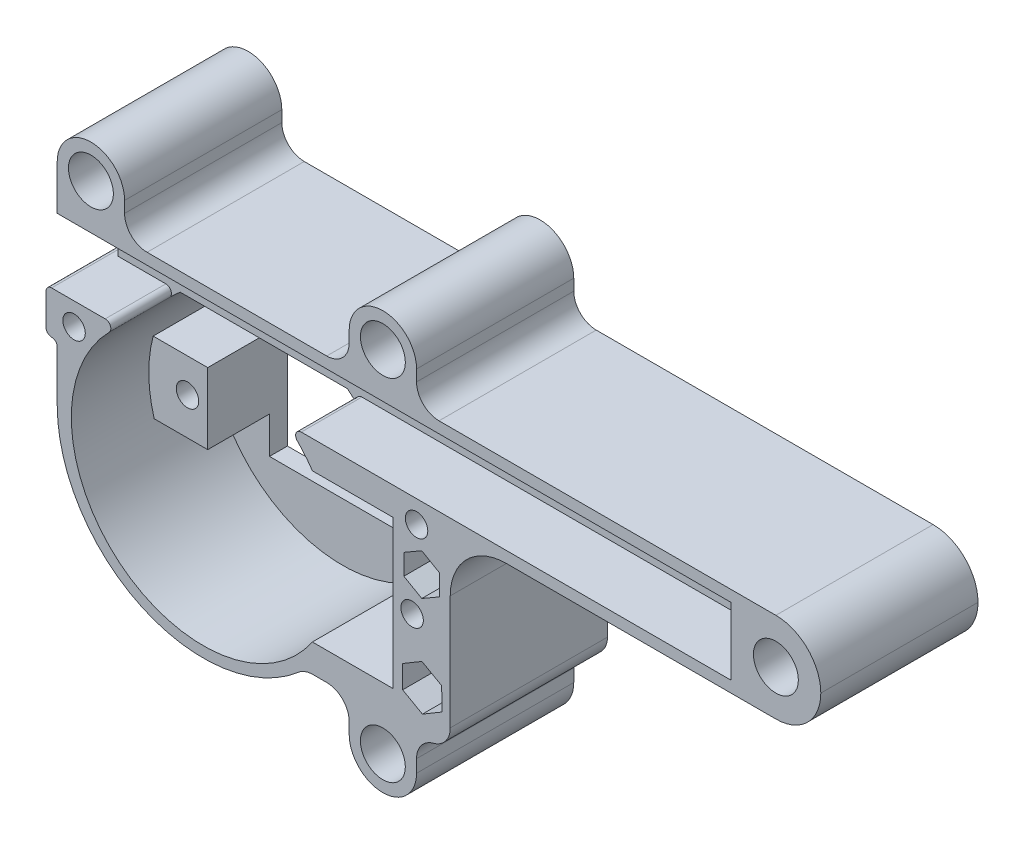
from build123d import *

# Parameters (mm, degrees)
BODY_DEPTH                      = 14
HAUPTAUSTRAGUNG_DEPTH           = 6.9
SERVOSCHNITT_DEPTH              = 69.010587411
SERVOSCHNITT_DEPTH_BACK         = 69.010587411
SERVO_W                         = 23.4
SERVO_H                         = 13.2
VERRUNDUNG2_R                   = 5
SCHRAUBENLOCH_DEPTH             = 69.010587411
SCHRAUBENLOCH_DEPTH_BACK        = 69.010587411
SERVOLOCHSCHRAUBEN_R            = 1
FUEHRUNG_W                      = 60
FUEHRUNG_H                      = 2.5
FUEHRUNGSSCHINE_DEPTH           = 1.5
VERRUNDUNG4_R                   = 2
HALTERUNG_R                     = 1
SCHNITT_LINEAR_AUSTRAGEN2_DEPTH = 69.010587411
SKIZZE5_R                       = 1
SCHNITT_LINEAR_AUSTRAGEN3_DEPTH = 69.010587411
SCHNITT_LINEAR_START            = -6
SKIZZE8_W                       = 2.673131507
SKIZZE8_H                       = 5.13849065
SCHNITT_LINEAR_AUSTRAGEN7_DEPTH = 73.931681587
LINEARES_MUSTER1_COUNT          = 11
LINEARES_MUSTER1_PITCH          = 5
SABSCHLUSS_W                    = 8
SABSCHLUSS_H                    = 8
ABSCHLUSS_DEPTH                 = 14
SKIZZE14_R                      = 2
ENDSTUTZEN_DEPTH                = 14
SKIZZESTUTZEN_R                 = 2
STUTZEN_DEPTH                   = 14
VERRUNDUNG5_R                   = 4
VERRUNDUNG6_R                   = 2
VERRUNDUNG7_R                   = 2
SECHSKANTLOCH_DEPTH             = 13
HALTERUNGLINKS_DEPTH            = 5.5
SKIZZE15_R                      = 2
AUFSATZ_LINEAR_AUSTRAGEN1_DEPTH = 14
VERRUNDUNG8_R                   = 2
SKIZZE16_W                      = 1
SKIZZE16_H                      = 3.8
AUFSATZ_LINEAR_AUSTRAGEN2_DEPTH = 14
VERRUNDUNG10_R                  = 0.5
VERRUNDUNG11_R                  = 0.5
VERRUNDUNG12_R                  = 0.5


with BuildPart() as part:
    # P-BodySkizze → body (new body)
    with BuildSketch(Plane.XY):
        with BuildLine():
            Line((0, 0), (60, 0))
            Line((60, 0), (60, -8))
            Line((60, -8), (35, -8))
            Line((35, -8), (35, -25.18083152))
            Line((35, -25.18083152), (22, -25.18083152))
            ThreePointArc((22, -25.18083152), (17.850215987, -27.861318538), (13, -28.8))
            ThreePointArc((13, -28.8), (3.807611845, -24.992388155), (0, -15.8))
            Line((0, -15.8), (0, 0))
        make_face()
    extrude(amount=BODY_DEPTH)

    # Austrag → hauptAustragung (cut)
    with BuildSketch(Plane.XY.offset(14)):
        with BuildLine():
            ThreePointArc((20.443697295, -7), (13.002720829, -4.343644442), (5.561744363, -7))
            Line((5.561744363, -7), (20.443697295, -7))
        make_face()
        with BuildLine():
            Line((20.443697295, -7), (5.561744363, -7))
            ThreePointArc((5.561744363, -7), (7.971268428, -26.711882843), (24.752720829, -16.093644442))
            ThreePointArc((24.752720829, -16.093644442), (23.62095923, -11.062192041), (20.443697295, -7))
        make_face()
        with BuildLine():
            Line((60, -1), (0, -1))
            Line((0, -1), (0, -7))
            Line((0, -7), (5.561744363, -7))
            ThreePointArc((5.561744363, -7), (13.002720829, -4.343644442), (20.443697295, -7))
            Line((20.443697295, -7), (60, -7))
            Line((60, -7), (60, -1))
        make_face()
    extrude(amount=-HAUPTAUSTRAGUNG_DEPTH, mode=Mode.SUBTRACT)

    # servo → ServoSchnitt (cut, two sides: drawn at the far end of the back side and taken through both)
    with BuildSketch(Plane.XY.offset(14).offset(-SERVOSCHNITT_DEPTH_BACK)):
        with Locations((18.202720829, -16.093644442)):
            Rectangle(SERVO_W, SERVO_H)
    extrude(amount=SERVOSCHNITT_DEPTH + SERVOSCHNITT_DEPTH_BACK, mode=Mode.SUBTRACT)

    # Verrundung2
    verrundung2_edges = [part.edges().sort_by_distance(p)[0] for p in [
        (35, -8, 7),
    ]]
    fillet(verrundung2_edges, radius=VERRUNDUNG2_R)

    # servolochschrauben → schraubenloch (cut, two sides: drawn at the far end of the back side and taken through both)
    with BuildSketch(Plane.XY.offset(14).offset(-SCHRAUBENLOCH_DEPTH_BACK)):
        with Locations((4.702720829, -16.094776923)):
            Circle(SERVOLOCHSCHRAUBEN_R)
        with Locations((31.602720829, -16.094776923)):
            Circle(SERVOLOCHSCHRAUBEN_R)
    extrude(amount=SCHRAUBENLOCH_DEPTH + SCHRAUBENLOCH_DEPTH_BACK, mode=Mode.SUBTRACT)

    # fuehrung → Fuehrungsschine (add)
    with BuildSketch(Plane.XY.offset(7.1)):
        with Locations((30, -5.75)):
            Rectangle(FUEHRUNG_W, FUEHRUNG_H)
    extrude(amount=FUEHRUNGSSCHINE_DEPTH)

    # Verrundung4
    verrundung4_edges = [part.edges().sort_by_distance(p)[0] for p in [
        (35, -25.18083152, 7),
    ]]
    fillet(verrundung4_edges, radius=VERRUNDUNG4_R)

    # halterung → Schnitt-Linear austragen2 (cut, through all)
    with BuildSketch(Plane.XY.offset(14)):
        with Locations((1.5, -9)):
            Circle(HALTERUNG_R)
    extrude(amount=-SCHNITT_LINEAR_AUSTRAGEN2_DEPTH, mode=Mode.SUBTRACT)

    # Skizze5 → Schnitt-Linear austragen3 (cut, through all)
    with BuildSketch(Plane.XY.offset(14)):
        with Locations((32, -9)):
            Circle(SKIZZE5_R)
    extrude(amount=-SCHNITT_LINEAR_AUSTRAGEN3_DEPTH, mode=Mode.SUBTRACT)

    # Skizze8 → Schnitt-Linear austragen7 (cut)
    with BuildSketch(Plane.XY.offset(7.1).offset(SCHNITT_LINEAR_START)):
        with Locations((4.124861588, -3.569245325)):
            Rectangle(SKIZZE8_W, SKIZZE8_H)
    schnitt_linear_austragen7 = extrude(amount=SCHNITT_LINEAR_AUSTRAGEN7_DEPTH, mode=Mode.SUBTRACT)

    # Lineares Muster1: Schnitt-Linear austragen7 ×11
    with Locations(*[(i * LINEARES_MUSTER1_PITCH, 0, 0) for i in range(1, LINEARES_MUSTER1_COUNT)]):
        add(schnitt_linear_austragen7, mode=Mode.SUBTRACT)

    # sabschluss → Abschluss (add)
    with BuildSketch(Plane.XY.offset(14)):
        with Locations((64, -4)):
            Rectangle(SABSCHLUSS_W, SABSCHLUSS_H)
    extrude(amount=-ABSCHLUSS_DEPTH)

    # Skizze14 → endstutzen (cut)
    with BuildSketch(Plane.XY.offset(14)):
        with Locations((64, -4)):
            Circle(SKIZZE14_R)
    extrude(amount=-ENDSTUTZEN_DEPTH, mode=Mode.SUBTRACT)

    # SkizzeStutzen → stutzen (add)
    # profile 1 of 2: a face of its own
    with BuildSketch(Plane.XY.offset(14)):
        with BuildLine():
            Line((32, -25.18083152), (26, -25.18083152))
            Line((26, -25.18083152), (26, -28.18083152))
            ThreePointArc((26, -28.18083152), (29, -31.18083152), (32, -28.18083152))
            Line((32, -28.18083152), (32, -25.18083152))
        make_face()
        with Locations((29, -28.18083152)):
            Circle(SKIZZESTUTZEN_R, mode=Mode.SUBTRACT)
    # profile 2 of 2: a face of its own
    with BuildSketch(Plane.XY.offset(14)):
        with BuildLine():
            Line((26, 3), (26, 0))
            Line((26, 0), (32, 0))
            Line((32, 0), (32, 3))
            ThreePointArc((32, 3), (29, 6), (26, 3))
        make_face()
        with Locations((29, 3)):
            Circle(SKIZZESTUTZEN_R, mode=Mode.SUBTRACT)
    extrude(amount=-STUTZEN_DEPTH)

    # Verrundung5
    verrundung5_edges = [part.edges().sort_by_distance(p)[0] for p in [
        (68, 0, 7),
        (68, -8, 7),
    ]]
    fillet(verrundung5_edges, radius=VERRUNDUNG5_R - 0.0001)  # a hair under: the kernel refuses the full size

    # Verrundung6
    verrundung6_edges = [part.edges().sort_by_distance(p)[0] for p in [
        (33, -25.18083152, 7),
        (26, -25.18083152, 7),
        (32, -25.18083152, 7),
        (32, 0, 7),
        (26, 0, 7),
    ]]
    fillet(verrundung6_edges, radius=VERRUNDUNG6_R)

    # Verrundung7
    verrundung7_edges = [part.edges().sort_by_distance(p)[0] for p in [
        (22, -25.18083152, 7),
    ]]
    fillet(verrundung7_edges, radius=VERRUNDUNG7_R)

    # sechskant-loch → sechskantloch (cut)
    with BuildSketch(Plane.XY.offset(14)):
        Polygon((34.261205516, -22.328313106), (34.238574988, -20.307713889), (32.477369472, -19.317012893), (30.738794484, -20.346911113), (30.761425012, -22.367510329), (32.522630528, -23.358211326), align=None)
        Polygon((32.465163938, -14.469262536), (34.059281734, -13.548898198), (34.059281734, -11.708169521), (32.465163938, -10.787805182), (30.871046143, -11.708169521), (30.871046143, -13.548898198), align=None)
    extrude(amount=-SECHSKANTLOCH_DEPTH, mode=Mode.SUBTRACT)

    # halterung links → halterungLinks (cut)
    with BuildSketch(Plane.XY.offset(7.1)):
        with BuildLine():
            Line((20.443697295, -7), (5.561744363, -7))
            ThreePointArc((5.561744363, -7), (3.120742136, -9.736837295), (1.642350763, -13.092895876))
            Line((1.642350763, -13.092895876), (6.502720829, -13.092895876))
            Line((6.502720829, -13.092895876), (6.502720829, -9.493644442))
            Line((6.502720829, -9.493644442), (22.723960462, -9.493644442))
            ThreePointArc((22.723960462, -9.493644442), (21.673936488, -8.164425124), (20.443697295, -7))
        make_face()
        with BuildLine():
            Line((6.502720829, -19.421283459), (1.733767081, -19.421283459))
            ThreePointArc((1.733767081, -19.421283459), (11.192764657, -27.703405794), (22.723960462, -22.693644442))
            Line((22.723960462, -22.693644442), (6.502720829, -22.693644442))
            Line((6.502720829, -22.693644442), (6.502720829, -19.421283459))
        make_face()
    extrude(amount=-HALTERUNGLINKS_DEPTH, mode=Mode.SUBTRACT)

    # Skizze15 → Aufsatz-Linear austragen1 (add)
    with BuildSketch(Plane.XY.offset(14)):
        with BuildLine():
            Line((0, 0), (6, 0))
            Line((6, 0), (6, 3))
            ThreePointArc((6, 3), (3, 6), (0, 3))
            Line((0, 3), (0, 0))
        make_face()
        with Locations((3, 3)):
            Circle(SKIZZE15_R, mode=Mode.SUBTRACT)
    extrude(amount=-AUFSATZ_LINEAR_AUSTRAGEN1_DEPTH)

    # Verrundung8
    verrundung8_edges = [part.edges().sort_by_distance(p)[0] for p in [
        (6, 0, 7),
    ]]
    fillet(verrundung8_edges, radius=VERRUNDUNG8_R)

    # Skizze16 → Aufsatz-Linear austragen2 (add)
    with BuildSketch(Plane.XY.offset(14)):
        with Locations((-0.5, -8.9)):
            Rectangle(SKIZZE16_W, SKIZZE16_H)
    extrude(amount=-AUFSATZ_LINEAR_AUSTRAGEN2_DEPTH)

    # Verrundung10
    verrundung10_edges = [part.edges().sort_by_distance(p)[0] for p in [
        (0, -10.8, 7),
        (-1, -10.8, 7),
        (-1, -7, 7),
    ]]
    fillet(verrundung10_edges, radius=VERRUNDUNG10_R - 0.0001)  # a hair under: the kernel refuses the full size

    # Verrundung11
    verrundung11_edges = [part.edges().sort_by_distance(p)[0] for p in [
        (5.561744363, -7, 11.3),
    ]]
    fillet(verrundung11_edges, radius=VERRUNDUNG11_R)

    # Verrundung12
    verrundung12_edges = [part.edges().sort_by_distance(p)[0] for p in [
        (20.443697295, -7, 11.3),
    ]]
    fillet(verrundung12_edges, radius=VERRUNDUNG12_R)


solid = part.part
